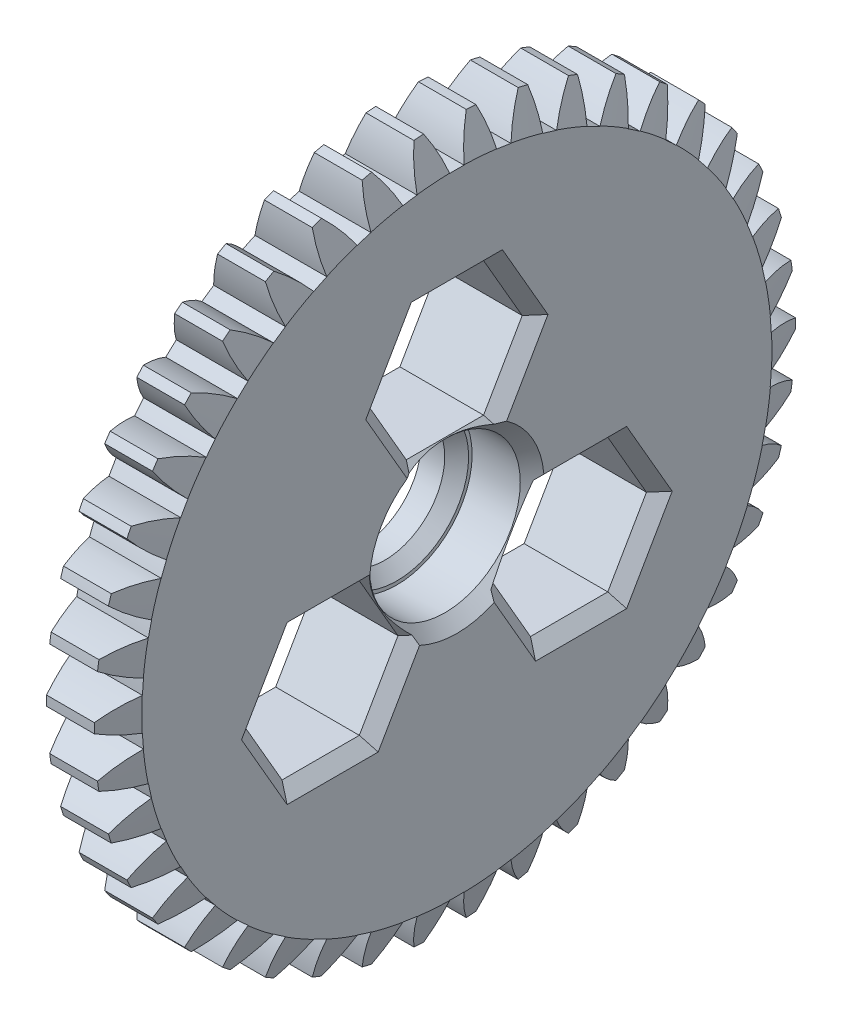
from build123d import *

# Parameters (mm, degrees)
BASPROSKE_W         = 4.7625
BASPROSKE_H         = 23.283333333
TOOTHCUT_DEPTH      = 34.270236375
TEETHCUTS_COUNT     = 42
TEETHCUTS_ANGLE     = 351.428571429
BORSKE_R            = 5.55625
BORE_DEPTH          = 4.7625
SKETCH1_R           = 15.875
SKETCH1_R_2         = 5.55625
BOSS_EXTRUDE1_DEPTH = 1.5875
CUT_EXTRUDE1_DEPTH  = 34.50436472
SKETCH3_R           = 3.9751
BOSS_EXTRUDE2_DEPTH = 6.35
CHAMFER1_SIZE       = 2.3622
CHAMFER1_SIZE2      = 0.79375
SKETCH4_R           = 5.0038
CUT_EXTRUDE2_DEPTH  = 3.9878
CHAMFER2_SIZE       = 0.79375
CHAMFER3_SIZE       = 0.79375
CHAMFER4_SIZE       = 0.79375
CHAMFER4_SIZE2      = 2.3622


with BuildPart() as part:
    # BasProSke → Base-Revolve (revolve)
    with BuildSketch(Plane(origin=(0, 0, 0), x_dir=(1, 0, 0), z_dir=(0, 1, 0)), mode=Mode.PRIVATE) as base_revolve_sk:
        with Locations((2.38125, 11.641666667)):
            Rectangle(BASPROSKE_W, BASPROSKE_H)
    revolve(base_revolve_sk.sketch.rotate(Axis((-10, 0, 0), (1, 0, 0)), 180), axis=Axis((-10, 0, 0), (1, 0, 0)))

    # TooCutSke → ToothCut (cut, through all)
    with BuildSketch(Plane(origin=(0, 0, 0), x_dir=(0, 0, -1), z_dir=(1, 0, 0))):
        with BuildLine():
            ThreePointArc((0.476912223, 20.898759111), (0, 20.9042), (-0.476912223, 20.898759111))
            ThreePointArc((-0.476912223, 20.898759111), (-0.868662684, 22.11616426), (-1.431037522, 23.264762651))
            ThreePointArc((-1.431037522, 23.264762651), (0, 23.308733333), (1.431037522, 23.264762651))
            ThreePointArc((1.431037522, 23.264762651), (0.868662684, 22.11616426), (0.476912223, 20.898759111))
        make_face()
    toothcut = extrude(amount=TOOTHCUT_DEPTH, mode=Mode.SUBTRACT)

    # TeethCuts: ToothCut ×42 about axis
    teethcuts_axis = Axis((-10, 0, 0), (1, 0, 0))
    for i in range(1, TEETHCUTS_COUNT):
        add(toothcut.rotate(teethcuts_axis, i * TEETHCUTS_ANGLE / (TEETHCUTS_COUNT - 1)), mode=Mode.SUBTRACT)

    # BorSke → Bore (cut, symmetric)
    with BuildSketch(Plane(origin=(0, 0, 0), x_dir=(0, 0, -1), z_dir=(1, 0, 0))):
        with Locations(Location((0, 0, 0), (0, 0, 180))):
            Circle(BORSKE_R)
    extrude(amount=BORE_DEPTH, both=True, mode=Mode.SUBTRACT)

    # Sketch1 → Boss-Extrude1 (add)
    with BuildSketch(Plane.ZY):
        with Locations(Location((0, 0, 0), (0, 0, 180))):
            Circle(SKETCH1_R)
        Circle(SKETCH1_R_2, mode=Mode.SUBTRACT)
    extrude(amount=BOSS_EXTRUDE1_DEPTH)

    # Sketch2 → Cut-Extrude1 (cut, through all)
    with BuildSketch(Plane(origin=(4.7625, 0, 0), x_dir=(0, 0, -1), z_dir=(1, 0, 0))):
        Polygon((5.682570024, -9.2075), (10.815213918, -9.2075), (13.381535864, -4.7625), (10.815213918, -0.3175), (5.682570024, -0.3175), (3.116248078, -4.7625), align=None)
        Polygon((5.132643893, 9.525), (2.566321947, 13.97), (-2.566321947, 13.97), (-5.132643893, 9.525), (-2.566321947, 5.08), (2.566321947, 5.08), align=None)
        Polygon((-10.815213918, -0.3175), (-13.381535864, -4.7625), (-10.815213918, -9.2075), (-5.682570024, -9.2075), (-3.116248078, -4.7625), (-5.682570024, -0.3175), align=None)
    extrude(amount=-CUT_EXTRUDE1_DEPTH, mode=Mode.SUBTRACT)

    # Sketch3 → Boss-Extrude2 (add)
    with BuildSketch(Plane(origin=(4.7625, 0, 0), x_dir=(0, 0, -1), z_dir=(1, 0, 0))):
        with BuildLine():
            Line((-3.274074205, -4.489137129), (-5.524743897, -0.590862871))
            ThreePointArc((-5.524743897, -0.590862871), (-4.81185365, 2.778125), (-2.250669692, 5.08))
            Line((-2.250669692, 5.08), (2.250669692, 5.08))
            ThreePointArc((2.250669692, 5.08), (4.81185365, 2.778125), (5.524743897, -0.590862871))
            Line((5.524743897, -0.590862871), (3.274074205, -4.489137129))
            ThreePointArc((3.274074205, -4.489137129), (0, -5.55625), (-3.274074205, -4.489137129))
        make_face()
        Circle(SKETCH3_R, mode=Mode.SUBTRACT)
    extrude(amount=-BOSS_EXTRUDE2_DEPTH)

    # Chamfer1
    chamfer1_edges = [part.edges().sort_by_distance(p)[0] for p in [
        (4.7625, 10.102259726, 20.977558474),
    ]]
    chamfer1_side = [part.faces().sort_by_distance(p)[0] for p in [
        (4.7625, 21.857891001, 1.473947546),
    ]]
    chamfer(chamfer1_edges, length=CHAMFER1_SIZE, length2=CHAMFER1_SIZE2, reference=chamfer1_side[0])

    # CirPattern1: read off the stored shape, not the designer's step
    # CirPattern1 outline → CirPattern1 (revolve, cut)
    with BuildSketch(Plane.YX):
        Polygon((23.283333333, 4.7625), (20.921133333, 4.7625), (23.283333333, 3.96875), align=None)
    revolve(axis=Axis((0, 0, 0), (1, 0, 0)), mode=Mode.SUBTRACT)

    # Sketch4 → Cut-Extrude2 (cut)
    with BuildSketch(Plane(origin=(4.7625, 0, 0), x_dir=(0, 0, -1), z_dir=(1, 0, 0))):
        Circle(SKETCH4_R)
    extrude(amount=-CUT_EXTRUDE2_DEPTH, mode=Mode.SUBTRACT)

    # Chamfer2
    chamfer2_edges = [part.edges().sort_by_distance(p)[0] for p in [
        (0.7747, 0, 3.9751),
    ]]
    chamfer(chamfer2_edges, length=CHAMFER2_SIZE)

    # Chamfer3
    # the kernel refuses this chamfer: 0.79375 mm, written as the material it takes off along each edge
    with BuildSketch(Plane(origin=(4.7625, 0, 0), x_dir=(0, 0, -1), z_dir=(0, -1, 0))) as chamfer3_piece_1:
        Polygon((5.0038, -CHAMFER3_SIZE), (5.0038 + CHAMFER3_SIZE, 0), (5.0038, 0), align=None)
    chamfer3_piece_1_solid = revolve(axis=Axis((4.7625, 0, 0), (1, 0, 0)), mode=Mode.PRIVATE)
    with BuildSketch(Plane(origin=(4.7625, 5.08, -4.607595318), x_dir=(0, -1, 0), z_dir=(0, 0, 1))) as chamfer3_piece_2_section:
        Polygon((CHAMFER3_SIZE, 0), (0, -CHAMFER3_SIZE), (0, 0), align=None)
    chamfer3_piece_2 = extrude(amount=9.215190636, mode=Mode.PRIVATE)
    chamfer3_piece_2 = split(chamfer3_piece_2, bisect_by=Plane(origin=(4.7625, 1.973602702, 0.77284263), z_dir=(0, 0.49999999999999994, -0.8660254037844387)), keep=Keep.TOP, mode=Mode.PRIVATE)
    chamfer3_piece_2 = split(chamfer3_piece_2, bisect_by=Plane(origin=(4.7625, 5.963897298, -3.076640289), z_dir=(0, 0.5000000000000001, 0.8660254037844387)), keep=Keep.TOP, mode=Mode.PRIVATE)
    with BuildSketch(Plane(origin=(4.7625, 3.312205404, -1.545685261), x_dir=(-2.237929876409765e-15, -0.5, -0.8660254037844386), z_dir=(0, 0.8660254037844387, -0.5000000000000001))) as chamfer3_piece_3_section:
        Polygon((CHAMFER3_SIZE, 0), (0, CHAMFER3_SIZE), (0, 0), align=None)
    chamfer3_piece_3 = extrude(amount=9.215190636, mode=Mode.PRIVATE)
    chamfer3_piece_3 = split(chamfer3_piece_3, bisect_by=Plane(origin=(4.7625, 5.08, -1.545685261), z_dir=(0, 1, 0)), keep=Keep.TOP, mode=Mode.PRIVATE)
    chamfer3_piece_3 = split(chamfer3_piece_3, bisect_by=Plane(origin=(4.7625, 6.418602702, -6.926123209), z_dir=(0, -0.5000000000000001, 0.8660254037844387)), keep=Keep.TOP, mode=Mode.PRIVATE)
    with BuildSketch(Plane(origin=(4.7625, 7.757205404, -6.153280579), x_dir=(-2.237929876409766e-15, 0.5000000000000001, -0.8660254037844387), z_dir=(0, 0.8660254037844387, 0.5000000000000001))) as chamfer3_piece_4_section:
        Polygon((CHAMFER3_SIZE, 0), (0, CHAMFER3_SIZE), (0, 0), align=None)
    chamfer3_piece_4 = extrude(amount=9.215190636, mode=Mode.PRIVATE)
    chamfer3_piece_4 = split(chamfer3_piece_4, bisect_by=Plane(origin=(4.7625, 13.97, -6.153280579), z_dir=(0, -1, 0)), keep=Keep.TOP, mode=Mode.PRIVATE)
    chamfer3_piece_4 = split(chamfer3_piece_4, bisect_by=Plane(origin=(4.7625, 8.641102702, -4.62232555), z_dir=(0, 0.5000000000000001, 0.8660254037844387)), keep=Keep.TOP, mode=Mode.PRIVATE)
    with BuildSketch(Plane(origin=(4.7625, 13.97, -4.607595318), x_dir=(0, 1, 0), z_dir=(0, 0, 1))) as chamfer3_piece_5_section:
        Polygon((CHAMFER3_SIZE, 0), (0, CHAMFER3_SIZE), (0, 0), align=None)
    chamfer3_piece_5 = extrude(amount=9.215190636, mode=Mode.PRIVATE)
    chamfer3_piece_5 = split(chamfer3_piece_5, bisect_by=Plane(origin=(4.7625, 17.076397298, 0.77284263), z_dir=(0, -0.5000000000000001, -0.8660254037844386)), keep=Keep.TOP, mode=Mode.PRIVATE)
    chamfer3_piece_5 = split(chamfer3_piece_5, bisect_by=Plane(origin=(4.7625, 13.086102702, -3.076640289), z_dir=(0, -0.5000000000000001, 0.8660254037844387)), keep=Keep.TOP, mode=Mode.PRIVATE)
    with BuildSketch(Plane(origin=(4.7625, 15.737794596, 1.545685261), x_dir=(-2.2379298764097628e-15, 0.5000000000000001, 0.8660254037844387), z_dir=(0, -0.8660254037844386, 0.5000000000000001))) as chamfer3_piece_6_section:
        Polygon((CHAMFER3_SIZE, 0), (0, CHAMFER3_SIZE), (0, 0), align=None)
    chamfer3_piece_6 = extrude(amount=9.215190636, mode=Mode.PRIVATE)
    chamfer3_piece_6 = split(chamfer3_piece_6, bisect_by=Plane(origin=(4.7625, 12.631397298, 6.926123209), z_dir=(0, 0.49999999999999994, -0.8660254037844387)), keep=Keep.TOP, mode=Mode.PRIVATE)
    chamfer3_piece_6 = split(chamfer3_piece_6, bisect_by=Plane(origin=(4.7625, 13.97, 1.545685261), z_dir=(0, -1, 0)), keep=Keep.TOP, mode=Mode.PRIVATE)
    with BuildSketch(Plane(origin=(4.7625, 11.292794596, 6.153280579), x_dir=(-2.2379298764097643e-15, -0.49999999999999994, 0.8660254037844387), z_dir=(0, -0.8660254037844387, -0.49999999999999994))) as chamfer3_piece_7_section:
        Polygon((CHAMFER3_SIZE, 0), (0, CHAMFER3_SIZE), (0, 0), align=None)
    chamfer3_piece_7 = extrude(amount=9.215190636, mode=Mode.PRIVATE)
    chamfer3_piece_7 = split(chamfer3_piece_7, bisect_by=Plane(origin=(4.7625, 10.408897298, 4.62232555), z_dir=(0, -0.5000000000000001, -0.8660254037844386)), keep=Keep.TOP, mode=Mode.PRIVATE)
    chamfer3_piece_7 = split(chamfer3_piece_7, bisect_by=Plane(origin=(4.7625, 5.08, 6.153280579), z_dir=(0, 1, 0)), keep=Keep.TOP, mode=Mode.PRIVATE)
    with BuildSketch(Plane(origin=(4.7625, -6.530294596, -2.095611392), x_dir=(-2.2379298764097647e-15, 0.5000000000000042, 0.8660254037844362), z_dir=(0, 0.8660254037844363, -0.5000000000000043))) as chamfer3_piece_8_section:
        Polygon((CHAMFER3_SIZE, 0), (0, -CHAMFER3_SIZE), (0, 0), align=None)
    chamfer3_piece_8 = extrude(amount=9.215190636, mode=Mode.PRIVATE)
    chamfer3_piece_8 = split(chamfer3_piece_8, bisect_by=Plane(origin=(4.7625, -0.3175, -2.095611392), z_dir=(0, -1, 0)), keep=Keep.TOP, mode=Mode.PRIVATE)
    chamfer3_piece_8 = split(chamfer3_piece_8, bisect_by=Plane(origin=(4.7625, -5.646397298, -3.626566421), z_dir=(0, 0.49999999999999584, -0.866025403784441)), keep=Keep.TOP, mode=Mode.PRIVATE)
    with BuildSketch(Plane(origin=(4.7625, -2.994705404, -2.095611392), x_dir=(-2.2379298764097635e-15, -0.4999999999999958, 0.866025403784441), z_dir=(0, -0.866025403784441, -0.49999999999999584))) as chamfer3_piece_9_section:
        Polygon((CHAMFER3_SIZE, 0), (0, CHAMFER3_SIZE), (0, 0), align=None)
    chamfer3_piece_9 = extrude(amount=9.215190636, mode=Mode.PRIVATE)
    chamfer3_piece_9 = split(chamfer3_piece_9, bisect_by=Plane(origin=(4.7625, -3.878602702, -3.626566421), z_dir=(0, -0.5000000000000043, -0.8660254037844363)), keep=Keep.TOP, mode=Mode.PRIVATE)
    chamfer3_piece_9 = split(chamfer3_piece_9, bisect_by=Plane(origin=(4.7625, -9.2075, -2.095611392), z_dir=(0, 1, 0)), keep=Keep.TOP, mode=Mode.PRIVATE)
    with BuildSketch(Plane(origin=(4.7625, -9.2075, -3.641296653), x_dir=(0, -1, 0), z_dir=(0, 0, -1))) as chamfer3_piece_10_section:
        Polygon((CHAMFER3_SIZE, 0), (0, CHAMFER3_SIZE), (0, 0), align=None)
    chamfer3_piece_10 = extrude(amount=9.215190636, mode=Mode.PRIVATE)
    chamfer3_piece_10 = split(chamfer3_piece_10, bisect_by=Plane(origin=(4.7625, -12.313897298, -9.021734601), z_dir=(0, 0.5000000000000038, 0.8660254037844365)), keep=Keep.TOP, mode=Mode.PRIVATE)
    chamfer3_piece_10 = split(chamfer3_piece_10, bisect_by=Plane(origin=(4.7625, -8.323602702, -5.172251682), z_dir=(0, 0.49999999999999584, -0.866025403784441)), keep=Keep.TOP, mode=Mode.PRIVATE)
    with BuildSketch(Plane(origin=(4.7625, -10.975294596, -9.794577232), x_dir=(-2.2379298764097635e-15, -0.5000000000000038, -0.8660254037844364), z_dir=(0, 0.8660254037844365, -0.5000000000000038))) as chamfer3_piece_11_section:
        Polygon((CHAMFER3_SIZE, 0), (0, CHAMFER3_SIZE), (0, 0), align=None)
    chamfer3_piece_11 = extrude(amount=9.215190636, mode=Mode.PRIVATE)
    chamfer3_piece_11 = split(chamfer3_piece_11, bisect_by=Plane(origin=(4.7625, -7.868897298, -15.17501518), z_dir=(0, -0.4999999999999959, 0.866025403784441)), keep=Keep.TOP, mode=Mode.PRIVATE)
    chamfer3_piece_11 = split(chamfer3_piece_11, bisect_by=Plane(origin=(4.7625, -9.2075, -9.794577232), z_dir=(0, 1, 0)), keep=Keep.TOP, mode=Mode.PRIVATE)
    with BuildSketch(Plane(origin=(4.7625, -6.530294596, -14.40217255), x_dir=(-2.237929876409765e-15, 0.49999999999999595, -0.866025403784441), z_dir=(0, 0.866025403784441, 0.4999999999999959))) as chamfer3_piece_12_section:
        Polygon((CHAMFER3_SIZE, 0), (0, CHAMFER3_SIZE), (0, 0), align=None)
    chamfer3_piece_12 = extrude(amount=9.215190636, mode=Mode.PRIVATE)
    chamfer3_piece_12 = split(chamfer3_piece_12, bisect_by=Plane(origin=(4.7625, -0.3175, -14.40217255), z_dir=(0, -1, 0)), keep=Keep.TOP, mode=Mode.PRIVATE)
    chamfer3_piece_12 = split(chamfer3_piece_12, bisect_by=Plane(origin=(4.7625, -5.646397298, -12.871217521), z_dir=(0, 0.5000000000000038, 0.8660254037844365)), keep=Keep.TOP, mode=Mode.PRIVATE)
    with BuildSketch(Plane(origin=(4.7625, -0.3175, -12.856487289), x_dir=(0, 1, 0), z_dir=(0, 0, 1))) as chamfer3_piece_13_section:
        Polygon((CHAMFER3_SIZE, 0), (0, CHAMFER3_SIZE), (0, 0), align=None)
    chamfer3_piece_13 = extrude(amount=9.215190636, mode=Mode.PRIVATE)
    chamfer3_piece_13 = split(chamfer3_piece_13, bisect_by=Plane(origin=(4.7625, -1.201397298, -11.325532261), z_dir=(0, -0.4999999999999959, 0.866025403784441)), keep=Keep.TOP, mode=Mode.PRIVATE)
    chamfer3_piece_13 = split(chamfer3_piece_13, bisect_by=Plane(origin=(4.7625, 2.788897298, -7.476049341), z_dir=(0, -0.5000000000000043, -0.8660254037844363)), keep=Keep.TOP, mode=Mode.PRIVATE)
    with BuildSketch(Plane(origin=(4.7625, 1.450294596, 6.70320671), x_dir=(-2.2379298764097643e-15, 0.4999999999999917, -0.8660254037844435), z_dir=(0, -0.8660254037844435, -0.4999999999999917))) as chamfer3_piece_14_section:
        Polygon((CHAMFER3_SIZE, 0), (0, -CHAMFER3_SIZE), (0, 0), align=None)
    chamfer3_piece_14 = extrude(amount=9.215190636, mode=Mode.PRIVATE)
    chamfer3_piece_14 = split(chamfer3_piece_14, bisect_by=Plane(origin=(4.7625, -1.656102702, 1.322768762), z_dir=(0, 0.5000000000000082, 0.8660254037844339)), keep=Keep.TOP, mode=Mode.PRIVATE)
    chamfer3_piece_14 = split(chamfer3_piece_14, bisect_by=Plane(origin=(4.7625, -0.3175, 6.70320671), z_dir=(0, -1, 0)), keep=Keep.TOP, mode=Mode.PRIVATE)
    with BuildSketch(Plane(origin=(4.7625, -0.3175, 3.641296653), x_dir=(0, 1, 0), z_dir=(0, 0, 1))) as chamfer3_piece_15_section:
        Polygon((CHAMFER3_SIZE, 0), (0, CHAMFER3_SIZE), (0, 0), align=None)
    chamfer3_piece_15 = extrude(amount=9.215190636, mode=Mode.PRIVATE)
    chamfer3_piece_15 = split(chamfer3_piece_15, bisect_by=Plane(origin=(4.7625, -1.201397298, 5.172251682), z_dir=(0, -0.4999999999999917, 0.8660254037844435)), keep=Keep.TOP, mode=Mode.PRIVATE)
    chamfer3_piece_15 = split(chamfer3_piece_15, bisect_by=Plane(origin=(4.7625, 2.788897298, 9.021734601), z_dir=(0, -0.5000000000000081, -0.8660254037844339)), keep=Keep.TOP, mode=Mode.PRIVATE)
    with BuildSketch(Plane(origin=(4.7625, 1.450294596, 9.794577232), x_dir=(-2.2379298764097635e-15, 0.5000000000000082, 0.8660254037844339), z_dir=(0, -0.866025403784434, 0.5000000000000082))) as chamfer3_piece_16_section:
        Polygon((CHAMFER3_SIZE, 0), (0, CHAMFER3_SIZE), (0, 0), align=None)
    chamfer3_piece_16 = extrude(amount=9.215190636, mode=Mode.PRIVATE)
    chamfer3_piece_16 = split(chamfer3_piece_16, bisect_by=Plane(origin=(4.7625, -1.656102702, 15.17501518), z_dir=(0, 0.4999999999999916, -0.8660254037844436)), keep=Keep.TOP, mode=Mode.PRIVATE)
    chamfer3_piece_16 = split(chamfer3_piece_16, bisect_by=Plane(origin=(4.7625, -0.3175, 9.794577232), z_dir=(0, -1, 0)), keep=Keep.TOP, mode=Mode.PRIVATE)
    with BuildSketch(Plane(origin=(4.7625, -2.994705404, 14.40217255), x_dir=(-2.2379298764097643e-15, -0.49999999999999156, 0.8660254037844435), z_dir=(0, -0.8660254037844435, -0.49999999999999156))) as chamfer3_piece_17_section:
        Polygon((CHAMFER3_SIZE, 0), (0, CHAMFER3_SIZE), (0, 0), align=None)
    chamfer3_piece_17 = extrude(amount=9.215190636, mode=Mode.PRIVATE)
    chamfer3_piece_17 = split(chamfer3_piece_17, bisect_by=Plane(origin=(4.7625, -9.2075, 14.40217255), z_dir=(0, 1, 0)), keep=Keep.TOP, mode=Mode.PRIVATE)
    chamfer3_piece_17 = split(chamfer3_piece_17, bisect_by=Plane(origin=(4.7625, -3.878602702, 12.871217521), z_dir=(0, -0.5000000000000081, -0.8660254037844339)), keep=Keep.TOP, mode=Mode.PRIVATE)
    with BuildSketch(Plane(origin=(4.7625, -9.2075, 12.856487289), x_dir=(0, -1, 0), z_dir=(0, 0, -1))) as chamfer3_piece_18_section:
        Polygon((CHAMFER3_SIZE, 0), (0, CHAMFER3_SIZE), (0, 0), align=None)
    chamfer3_piece_18 = extrude(amount=9.215190636, mode=Mode.PRIVATE)
    chamfer3_piece_18 = split(chamfer3_piece_18, bisect_by=Plane(origin=(4.7625, -12.313897298, 7.476049341), z_dir=(0, 0.5000000000000082, 0.8660254037844339)), keep=Keep.TOP, mode=Mode.PRIVATE)
    chamfer3_piece_18 = split(chamfer3_piece_18, bisect_by=Plane(origin=(4.7625, -8.323602702, 11.325532261), z_dir=(0, 0.4999999999999916, -0.8660254037844436)), keep=Keep.TOP, mode=Mode.PRIVATE)
    with BuildSketch(Plane(origin=(4.7625, -10.975294596, 6.70320671), x_dir=(-2.2379298764097628e-15, -0.5000000000000082, -0.8660254037844339), z_dir=(0, 0.8660254037844339, -0.5000000000000082))) as chamfer3_piece_19_section:
        Polygon((CHAMFER3_SIZE, 0), (0, CHAMFER3_SIZE), (0, 0), align=None)
    chamfer3_piece_19 = extrude(amount=9.215190636, mode=Mode.PRIVATE)
    chamfer3_piece_19 = split(chamfer3_piece_19, bisect_by=Plane(origin=(4.7625, -9.2075, 6.70320671), z_dir=(0, 1, 0)), keep=Keep.TOP, mode=Mode.PRIVATE)
    chamfer3_piece_19 = split(chamfer3_piece_19, bisect_by=Plane(origin=(4.7625, -7.868897298, 1.322768762), z_dir=(0, -0.4999999999999917, 0.8660254037844435)), keep=Keep.TOP, mode=Mode.PRIVATE)
    with BuildSketch(Plane(origin=(4.7625, 5.08, -4.607595318), x_dir=(0, -1, 0), z_dir=(0, 0, 1))) as chamfer3_piece_20a_section:
        Polygon((CHAMFER3_SIZE, 0), (0, -CHAMFER3_SIZE), (0, 0), align=None)
    chamfer3_piece_20a = extrude(amount=9.215190636, mode=Mode.PRIVATE)
    chamfer3_piece_20a = chamfer3_piece_20a - Plane(origin=(4.7625, 0, 0), x_dir=(0, 0, -1), z_dir=(1, 0, 0)) * Cylinder(5.0038, 22, mode=Mode.PRIVATE)
    chamfer3_piece_20a = split(chamfer3_piece_20a, bisect_by=Plane(origin=(4.7625, 5.963897298, -3.076640289), z_dir=(0, -0.5000000000000001, -0.8660254037844387)), keep=Keep.TOP, mode=Mode.PRIVATE)
    with BuildSketch(Plane(origin=(4.7625, 3.312205404, -1.545685261), x_dir=(-2.237929876409765e-15, -0.5, -0.8660254037844386), z_dir=(0, 0.8660254037844387, -0.5000000000000001))) as chamfer3_piece_20b_section:
        Polygon((CHAMFER3_SIZE, 0), (0, CHAMFER3_SIZE), (0, 0), align=None)
    chamfer3_piece_20b = extrude(amount=9.215190636, mode=Mode.PRIVATE)
    chamfer3_piece_20b = chamfer3_piece_20b - Plane(origin=(4.7625, 0, 0), x_dir=(0, 0, -1), z_dir=(1, 0, 0)) * Cylinder(5.0038, 22, mode=Mode.PRIVATE)
    chamfer3_piece_20b = split(chamfer3_piece_20b, bisect_by=Plane(origin=(4.7625, 5.08, -1.545685261), z_dir=(0, -1, 0)), keep=Keep.TOP, mode=Mode.PRIVATE)
    chamfer3_piece_20 = chamfer3_piece_20a & chamfer3_piece_20b
    with BuildSketch(Plane(origin=(4.7625, 11.292794596, 6.153280579), x_dir=(-2.2379298764097643e-15, -0.49999999999999994, 0.8660254037844387), z_dir=(0, -0.8660254037844387, -0.49999999999999994))) as chamfer3_piece_21a_section:
        Polygon((CHAMFER3_SIZE, 0), (0, CHAMFER3_SIZE), (0, 0), align=None)
    chamfer3_piece_21a = extrude(amount=9.215190636, mode=Mode.PRIVATE)
    chamfer3_piece_21a = chamfer3_piece_21a - Plane(origin=(4.7625, 0, 0), x_dir=(0, 0, -1), z_dir=(1, 0, 0)) * Cylinder(5.0038, 22, mode=Mode.PRIVATE)
    chamfer3_piece_21a = split(chamfer3_piece_21a, bisect_by=Plane(origin=(4.7625, 5.08, 6.153280579), z_dir=(0, -1, 0)), keep=Keep.TOP, mode=Mode.PRIVATE)
    with BuildSketch(Plane(origin=(4.7625, 5.08, -4.607595318), x_dir=(0, -1, 0), z_dir=(0, 0, 1))) as chamfer3_piece_21b_section:
        Polygon((CHAMFER3_SIZE, 0), (0, -CHAMFER3_SIZE), (0, 0), align=None)
    chamfer3_piece_21b = extrude(amount=9.215190636, mode=Mode.PRIVATE)
    chamfer3_piece_21b = chamfer3_piece_21b - Plane(origin=(4.7625, 0, 0), x_dir=(0, 0, -1), z_dir=(1, 0, 0)) * Cylinder(5.0038, 22, mode=Mode.PRIVATE)
    chamfer3_piece_21b = split(chamfer3_piece_21b, bisect_by=Plane(origin=(4.7625, 1.973602702, 0.77284263), z_dir=(0, -0.49999999999999994, 0.8660254037844387)), keep=Keep.TOP, mode=Mode.PRIVATE)
    chamfer3_piece_21 = chamfer3_piece_21a & chamfer3_piece_21b
    with BuildSketch(Plane(origin=(4.7625, 3.312205404, -1.545685261), x_dir=(-2.237929876409765e-15, -0.5, -0.8660254037844386), z_dir=(0, 0.8660254037844387, -0.5000000000000001))) as chamfer3_piece_22a_section:
        Polygon((CHAMFER3_SIZE, 0), (0, CHAMFER3_SIZE), (0, 0), align=None)
    chamfer3_piece_22a = extrude(amount=9.215190636, mode=Mode.PRIVATE)
    chamfer3_piece_22a = split(chamfer3_piece_22a, bisect_by=Plane(origin=(4.7625, 6.418602702, -6.926123209), z_dir=(0, 0.5000000000000001, -0.8660254037844387)), keep=Keep.TOP, mode=Mode.PRIVATE)
    with BuildSketch(Plane(origin=(4.7625, 7.757205404, -6.153280579), x_dir=(-2.237929876409766e-15, 0.5000000000000001, -0.8660254037844387), z_dir=(0, 0.8660254037844387, 0.5000000000000001))) as chamfer3_piece_22b_section:
        Polygon((CHAMFER3_SIZE, 0), (0, CHAMFER3_SIZE), (0, 0), align=None)
    chamfer3_piece_22b = extrude(amount=9.215190636, mode=Mode.PRIVATE)
    chamfer3_piece_22b = split(chamfer3_piece_22b, bisect_by=Plane(origin=(4.7625, 8.641102702, -4.62232555), z_dir=(0, -0.5000000000000001, -0.8660254037844387)), keep=Keep.TOP, mode=Mode.PRIVATE)
    chamfer3_piece_22 = chamfer3_piece_22a & chamfer3_piece_22b
    with BuildSketch(Plane(origin=(4.7625, 13.97, -4.607595318), x_dir=(0, 1, 0), z_dir=(0, 0, 1))) as chamfer3_piece_23a_section:
        Polygon((CHAMFER3_SIZE, 0), (0, CHAMFER3_SIZE), (0, 0), align=None)
    chamfer3_piece_23a = extrude(amount=9.215190636, mode=Mode.PRIVATE)
    chamfer3_piece_23a = split(chamfer3_piece_23a, bisect_by=Plane(origin=(4.7625, 13.086102702, -3.076640289), z_dir=(0, 0.5000000000000001, -0.8660254037844387)), keep=Keep.TOP, mode=Mode.PRIVATE)
    with BuildSketch(Plane(origin=(4.7625, 7.757205404, -6.153280579), x_dir=(-2.237929876409766e-15, 0.5000000000000001, -0.8660254037844387), z_dir=(0, 0.8660254037844387, 0.5000000000000001))) as chamfer3_piece_23b_section:
        Polygon((CHAMFER3_SIZE, 0), (0, CHAMFER3_SIZE), (0, 0), align=None)
    chamfer3_piece_23b = extrude(amount=9.215190636, mode=Mode.PRIVATE)
    chamfer3_piece_23b = split(chamfer3_piece_23b, bisect_by=Plane(origin=(4.7625, 13.97, -6.153280579), z_dir=(0, 1, 0)), keep=Keep.TOP, mode=Mode.PRIVATE)
    chamfer3_piece_23 = chamfer3_piece_23a & chamfer3_piece_23b
    with BuildSketch(Plane(origin=(4.7625, 15.737794596, 1.545685261), x_dir=(-2.2379298764097628e-15, 0.5000000000000001, 0.8660254037844387), z_dir=(0, -0.8660254037844386, 0.5000000000000001))) as chamfer3_piece_24a_section:
        Polygon((CHAMFER3_SIZE, 0), (0, CHAMFER3_SIZE), (0, 0), align=None)
    chamfer3_piece_24a = extrude(amount=9.215190636, mode=Mode.PRIVATE)
    chamfer3_piece_24a = split(chamfer3_piece_24a, bisect_by=Plane(origin=(4.7625, 13.97, 1.545685261), z_dir=(0, 1, 0)), keep=Keep.TOP, mode=Mode.PRIVATE)
    with BuildSketch(Plane(origin=(4.7625, 13.97, -4.607595318), x_dir=(0, 1, 0), z_dir=(0, 0, 1))) as chamfer3_piece_24b_section:
        Polygon((CHAMFER3_SIZE, 0), (0, CHAMFER3_SIZE), (0, 0), align=None)
    chamfer3_piece_24b = extrude(amount=9.215190636, mode=Mode.PRIVATE)
    chamfer3_piece_24b = split(chamfer3_piece_24b, bisect_by=Plane(origin=(4.7625, 17.076397298, 0.77284263), z_dir=(0, 0.5000000000000001, 0.8660254037844386)), keep=Keep.TOP, mode=Mode.PRIVATE)
    chamfer3_piece_24 = chamfer3_piece_24a & chamfer3_piece_24b
    with BuildSketch(Plane(origin=(4.7625, 11.292794596, 6.153280579), x_dir=(-2.2379298764097643e-15, -0.49999999999999994, 0.8660254037844387), z_dir=(0, -0.8660254037844387, -0.49999999999999994))) as chamfer3_piece_25a_section:
        Polygon((CHAMFER3_SIZE, 0), (0, CHAMFER3_SIZE), (0, 0), align=None)
    chamfer3_piece_25a = extrude(amount=9.215190636, mode=Mode.PRIVATE)
    chamfer3_piece_25a = split(chamfer3_piece_25a, bisect_by=Plane(origin=(4.7625, 10.408897298, 4.62232555), z_dir=(0, 0.5000000000000001, 0.8660254037844386)), keep=Keep.TOP, mode=Mode.PRIVATE)
    with BuildSketch(Plane(origin=(4.7625, 15.737794596, 1.545685261), x_dir=(-2.2379298764097628e-15, 0.5000000000000001, 0.8660254037844387), z_dir=(0, -0.8660254037844386, 0.5000000000000001))) as chamfer3_piece_25b_section:
        Polygon((CHAMFER3_SIZE, 0), (0, CHAMFER3_SIZE), (0, 0), align=None)
    chamfer3_piece_25b = extrude(amount=9.215190636, mode=Mode.PRIVATE)
    chamfer3_piece_25b = split(chamfer3_piece_25b, bisect_by=Plane(origin=(4.7625, 12.631397298, 6.926123209), z_dir=(0, -0.49999999999999994, 0.8660254037844387)), keep=Keep.TOP, mode=Mode.PRIVATE)
    chamfer3_piece_25 = chamfer3_piece_25a & chamfer3_piece_25b
    with BuildSketch(Plane(origin=(4.7625, -6.530294596, -2.095611392), x_dir=(-2.2379298764097647e-15, 0.5000000000000042, 0.8660254037844362), z_dir=(0, 0.8660254037844363, -0.5000000000000043))) as chamfer3_piece_26a_section:
        Polygon((CHAMFER3_SIZE, 0), (0, -CHAMFER3_SIZE), (0, 0), align=None)
    chamfer3_piece_26a = extrude(amount=9.215190636, mode=Mode.PRIVATE)
    chamfer3_piece_26a = chamfer3_piece_26a - Plane(origin=(4.7625, 0, 0), x_dir=(0, 0, -1), z_dir=(1, 0, 0)) * Cylinder(5.0038, 22, mode=Mode.PRIVATE)
    chamfer3_piece_26a = split(chamfer3_piece_26a, bisect_by=Plane(origin=(4.7625, -5.646397298, -3.626566421), z_dir=(0, -0.49999999999999584, 0.866025403784441)), keep=Keep.TOP, mode=Mode.PRIVATE)
    with BuildSketch(Plane(origin=(4.7625, -2.994705404, -2.095611392), x_dir=(-2.2379298764097635e-15, -0.4999999999999958, 0.866025403784441), z_dir=(0, -0.866025403784441, -0.49999999999999584))) as chamfer3_piece_26b_section:
        Polygon((CHAMFER3_SIZE, 0), (0, CHAMFER3_SIZE), (0, 0), align=None)
    chamfer3_piece_26b = extrude(amount=9.215190636, mode=Mode.PRIVATE)
    chamfer3_piece_26b = chamfer3_piece_26b - Plane(origin=(4.7625, 0, 0), x_dir=(0, 0, -1), z_dir=(1, 0, 0)) * Cylinder(5.0038, 22, mode=Mode.PRIVATE)
    chamfer3_piece_26b = split(chamfer3_piece_26b, bisect_by=Plane(origin=(4.7625, -3.878602702, -3.626566421), z_dir=(0, 0.5000000000000043, 0.8660254037844363)), keep=Keep.TOP, mode=Mode.PRIVATE)
    chamfer3_piece_26 = chamfer3_piece_26a & chamfer3_piece_26b
    with BuildSketch(Plane(origin=(4.7625, -0.3175, -12.856487289), x_dir=(0, 1, 0), z_dir=(0, 0, 1))) as chamfer3_piece_27a_section:
        Polygon((CHAMFER3_SIZE, 0), (0, CHAMFER3_SIZE), (0, 0), align=None)
    chamfer3_piece_27a = extrude(amount=9.215190636, mode=Mode.PRIVATE)
    chamfer3_piece_27a = chamfer3_piece_27a - Plane(origin=(4.7625, 0, 0), x_dir=(0, 0, -1), z_dir=(1, 0, 0)) * Cylinder(5.0038, 22, mode=Mode.PRIVATE)
    chamfer3_piece_27a = split(chamfer3_piece_27a, bisect_by=Plane(origin=(4.7625, 2.788897298, -7.476049341), z_dir=(0, 0.5000000000000043, 0.8660254037844363)), keep=Keep.TOP, mode=Mode.PRIVATE)
    with BuildSketch(Plane(origin=(4.7625, -6.530294596, -2.095611392), x_dir=(-2.2379298764097647e-15, 0.5000000000000042, 0.8660254037844362), z_dir=(0, 0.8660254037844363, -0.5000000000000043))) as chamfer3_piece_27b_section:
        Polygon((CHAMFER3_SIZE, 0), (0, -CHAMFER3_SIZE), (0, 0), align=None)
    chamfer3_piece_27b = extrude(amount=9.215190636, mode=Mode.PRIVATE)
    chamfer3_piece_27b = chamfer3_piece_27b - Plane(origin=(4.7625, 0, 0), x_dir=(0, 0, -1), z_dir=(1, 0, 0)) * Cylinder(5.0038, 22, mode=Mode.PRIVATE)
    chamfer3_piece_27b = split(chamfer3_piece_27b, bisect_by=Plane(origin=(4.7625, -0.3175, -2.095611392), z_dir=(0, 1, 0)), keep=Keep.TOP, mode=Mode.PRIVATE)
    chamfer3_piece_27 = chamfer3_piece_27a & chamfer3_piece_27b
    with BuildSketch(Plane(origin=(4.7625, -2.994705404, -2.095611392), x_dir=(-2.2379298764097635e-15, -0.4999999999999958, 0.866025403784441), z_dir=(0, -0.866025403784441, -0.49999999999999584))) as chamfer3_piece_28a_section:
        Polygon((CHAMFER3_SIZE, 0), (0, CHAMFER3_SIZE), (0, 0), align=None)
    chamfer3_piece_28a = extrude(amount=9.215190636, mode=Mode.PRIVATE)
    chamfer3_piece_28a = split(chamfer3_piece_28a, bisect_by=Plane(origin=(4.7625, -9.2075, -2.095611392), z_dir=(0, -1, 0)), keep=Keep.TOP, mode=Mode.PRIVATE)
    with BuildSketch(Plane(origin=(4.7625, -9.2075, -3.641296653), x_dir=(0, -1, 0), z_dir=(0, 0, -1))) as chamfer3_piece_28b_section:
        Polygon((CHAMFER3_SIZE, 0), (0, CHAMFER3_SIZE), (0, 0), align=None)
    chamfer3_piece_28b = extrude(amount=9.215190636, mode=Mode.PRIVATE)
    chamfer3_piece_28b = split(chamfer3_piece_28b, bisect_by=Plane(origin=(4.7625, -8.323602702, -5.172251682), z_dir=(0, -0.49999999999999584, 0.866025403784441)), keep=Keep.TOP, mode=Mode.PRIVATE)
    chamfer3_piece_28 = chamfer3_piece_28a & chamfer3_piece_28b
    with BuildSketch(Plane(origin=(4.7625, -10.975294596, -9.794577232), x_dir=(-2.2379298764097635e-15, -0.5000000000000038, -0.8660254037844364), z_dir=(0, 0.8660254037844365, -0.5000000000000038))) as chamfer3_piece_29a_section:
        Polygon((CHAMFER3_SIZE, 0), (0, CHAMFER3_SIZE), (0, 0), align=None)
    chamfer3_piece_29a = extrude(amount=9.215190636, mode=Mode.PRIVATE)
    chamfer3_piece_29a = split(chamfer3_piece_29a, bisect_by=Plane(origin=(4.7625, -9.2075, -9.794577232), z_dir=(0, -1, 0)), keep=Keep.TOP, mode=Mode.PRIVATE)
    with BuildSketch(Plane(origin=(4.7625, -9.2075, -3.641296653), x_dir=(0, -1, 0), z_dir=(0, 0, -1))) as chamfer3_piece_29b_section:
        Polygon((CHAMFER3_SIZE, 0), (0, CHAMFER3_SIZE), (0, 0), align=None)
    chamfer3_piece_29b = extrude(amount=9.215190636, mode=Mode.PRIVATE)
    chamfer3_piece_29b = split(chamfer3_piece_29b, bisect_by=Plane(origin=(4.7625, -12.313897298, -9.021734601), z_dir=(0, -0.5000000000000038, -0.8660254037844365)), keep=Keep.TOP, mode=Mode.PRIVATE)
    chamfer3_piece_29 = chamfer3_piece_29a & chamfer3_piece_29b
    with BuildSketch(Plane(origin=(4.7625, -6.530294596, -14.40217255), x_dir=(-2.237929876409765e-15, 0.49999999999999595, -0.866025403784441), z_dir=(0, 0.866025403784441, 0.4999999999999959))) as chamfer3_piece_30a_section:
        Polygon((CHAMFER3_SIZE, 0), (0, CHAMFER3_SIZE), (0, 0), align=None)
    chamfer3_piece_30a = extrude(amount=9.215190636, mode=Mode.PRIVATE)
    chamfer3_piece_30a = split(chamfer3_piece_30a, bisect_by=Plane(origin=(4.7625, -5.646397298, -12.871217521), z_dir=(0, -0.5000000000000038, -0.8660254037844365)), keep=Keep.TOP, mode=Mode.PRIVATE)
    with BuildSketch(Plane(origin=(4.7625, -10.975294596, -9.794577232), x_dir=(-2.2379298764097635e-15, -0.5000000000000038, -0.8660254037844364), z_dir=(0, 0.8660254037844365, -0.5000000000000038))) as chamfer3_piece_30b_section:
        Polygon((CHAMFER3_SIZE, 0), (0, CHAMFER3_SIZE), (0, 0), align=None)
    chamfer3_piece_30b = extrude(amount=9.215190636, mode=Mode.PRIVATE)
    chamfer3_piece_30b = split(chamfer3_piece_30b, bisect_by=Plane(origin=(4.7625, -7.868897298, -15.17501518), z_dir=(0, 0.4999999999999959, -0.866025403784441)), keep=Keep.TOP, mode=Mode.PRIVATE)
    chamfer3_piece_30 = chamfer3_piece_30a & chamfer3_piece_30b
    with BuildSketch(Plane(origin=(4.7625, -0.3175, -12.856487289), x_dir=(0, 1, 0), z_dir=(0, 0, 1))) as chamfer3_piece_31a_section:
        Polygon((CHAMFER3_SIZE, 0), (0, CHAMFER3_SIZE), (0, 0), align=None)
    chamfer3_piece_31a = extrude(amount=9.215190636, mode=Mode.PRIVATE)
    chamfer3_piece_31a = split(chamfer3_piece_31a, bisect_by=Plane(origin=(4.7625, -1.201397298, -11.325532261), z_dir=(0, 0.4999999999999959, -0.866025403784441)), keep=Keep.TOP, mode=Mode.PRIVATE)
    with BuildSketch(Plane(origin=(4.7625, -6.530294596, -14.40217255), x_dir=(-2.237929876409765e-15, 0.49999999999999595, -0.866025403784441), z_dir=(0, 0.866025403784441, 0.4999999999999959))) as chamfer3_piece_31b_section:
        Polygon((CHAMFER3_SIZE, 0), (0, CHAMFER3_SIZE), (0, 0), align=None)
    chamfer3_piece_31b = extrude(amount=9.215190636, mode=Mode.PRIVATE)
    chamfer3_piece_31b = split(chamfer3_piece_31b, bisect_by=Plane(origin=(4.7625, -0.3175, -14.40217255), z_dir=(0, 1, 0)), keep=Keep.TOP, mode=Mode.PRIVATE)
    chamfer3_piece_31 = chamfer3_piece_31a & chamfer3_piece_31b
    with BuildSketch(Plane(origin=(4.7625, 1.450294596, 6.70320671), x_dir=(-2.2379298764097643e-15, 0.4999999999999917, -0.8660254037844435), z_dir=(0, -0.8660254037844435, -0.4999999999999917))) as chamfer3_piece_32a_section:
        Polygon((CHAMFER3_SIZE, 0), (0, -CHAMFER3_SIZE), (0, 0), align=None)
    chamfer3_piece_32a = extrude(amount=9.215190636, mode=Mode.PRIVATE)
    chamfer3_piece_32a = chamfer3_piece_32a - Plane(origin=(4.7625, 0, 0), x_dir=(0, 0, -1), z_dir=(1, 0, 0)) * Cylinder(5.0038, 22, mode=Mode.PRIVATE)
    chamfer3_piece_32a = split(chamfer3_piece_32a, bisect_by=Plane(origin=(4.7625, -0.3175, 6.70320671), z_dir=(0, 1, 0)), keep=Keep.TOP, mode=Mode.PRIVATE)
    with BuildSketch(Plane(origin=(4.7625, -0.3175, 3.641296653), x_dir=(0, 1, 0), z_dir=(0, 0, 1))) as chamfer3_piece_32b_section:
        Polygon((CHAMFER3_SIZE, 0), (0, CHAMFER3_SIZE), (0, 0), align=None)
    chamfer3_piece_32b = extrude(amount=9.215190636, mode=Mode.PRIVATE)
    chamfer3_piece_32b = chamfer3_piece_32b - Plane(origin=(4.7625, 0, 0), x_dir=(0, 0, -1), z_dir=(1, 0, 0)) * Cylinder(5.0038, 22, mode=Mode.PRIVATE)
    chamfer3_piece_32b = split(chamfer3_piece_32b, bisect_by=Plane(origin=(4.7625, -1.201397298, 5.172251682), z_dir=(0, 0.4999999999999917, -0.8660254037844435)), keep=Keep.TOP, mode=Mode.PRIVATE)
    chamfer3_piece_32 = chamfer3_piece_32a & chamfer3_piece_32b
    with BuildSketch(Plane(origin=(4.7625, -10.975294596, 6.70320671), x_dir=(-2.2379298764097628e-15, -0.5000000000000082, -0.8660254037844339), z_dir=(0, 0.8660254037844339, -0.5000000000000082))) as chamfer3_piece_33a_section:
        Polygon((CHAMFER3_SIZE, 0), (0, CHAMFER3_SIZE), (0, 0), align=None)
    chamfer3_piece_33a = extrude(amount=9.215190636, mode=Mode.PRIVATE)
    chamfer3_piece_33a = chamfer3_piece_33a - Plane(origin=(4.7625, 0, 0), x_dir=(0, 0, -1), z_dir=(1, 0, 0)) * Cylinder(5.0038, 22, mode=Mode.PRIVATE)
    chamfer3_piece_33a = split(chamfer3_piece_33a, bisect_by=Plane(origin=(4.7625, -7.868897298, 1.322768762), z_dir=(0, 0.4999999999999917, -0.8660254037844435)), keep=Keep.TOP, mode=Mode.PRIVATE)
    with BuildSketch(Plane(origin=(4.7625, 1.450294596, 6.70320671), x_dir=(-2.2379298764097643e-15, 0.4999999999999917, -0.8660254037844435), z_dir=(0, -0.8660254037844435, -0.4999999999999917))) as chamfer3_piece_33b_section:
        Polygon((CHAMFER3_SIZE, 0), (0, -CHAMFER3_SIZE), (0, 0), align=None)
    chamfer3_piece_33b = extrude(amount=9.215190636, mode=Mode.PRIVATE)
    chamfer3_piece_33b = chamfer3_piece_33b - Plane(origin=(4.7625, 0, 0), x_dir=(0, 0, -1), z_dir=(1, 0, 0)) * Cylinder(5.0038, 22, mode=Mode.PRIVATE)
    chamfer3_piece_33b = split(chamfer3_piece_33b, bisect_by=Plane(origin=(4.7625, -1.656102702, 1.322768762), z_dir=(0, -0.5000000000000082, -0.8660254037844339)), keep=Keep.TOP, mode=Mode.PRIVATE)
    chamfer3_piece_33 = chamfer3_piece_33a & chamfer3_piece_33b
    with BuildSketch(Plane(origin=(4.7625, -0.3175, 3.641296653), x_dir=(0, 1, 0), z_dir=(0, 0, 1))) as chamfer3_piece_34a_section:
        Polygon((CHAMFER3_SIZE, 0), (0, CHAMFER3_SIZE), (0, 0), align=None)
    chamfer3_piece_34a = extrude(amount=9.215190636, mode=Mode.PRIVATE)
    chamfer3_piece_34a = split(chamfer3_piece_34a, bisect_by=Plane(origin=(4.7625, 2.788897298, 9.021734601), z_dir=(0, 0.5000000000000081, 0.8660254037844339)), keep=Keep.TOP, mode=Mode.PRIVATE)
    with BuildSketch(Plane(origin=(4.7625, 1.450294596, 9.794577232), x_dir=(-2.2379298764097635e-15, 0.5000000000000082, 0.8660254037844339), z_dir=(0, -0.866025403784434, 0.5000000000000082))) as chamfer3_piece_34b_section:
        Polygon((CHAMFER3_SIZE, 0), (0, CHAMFER3_SIZE), (0, 0), align=None)
    chamfer3_piece_34b = extrude(amount=9.215190636, mode=Mode.PRIVATE)
    chamfer3_piece_34b = split(chamfer3_piece_34b, bisect_by=Plane(origin=(4.7625, -0.3175, 9.794577232), z_dir=(0, 1, 0)), keep=Keep.TOP, mode=Mode.PRIVATE)
    chamfer3_piece_34 = chamfer3_piece_34a & chamfer3_piece_34b
    with BuildSketch(Plane(origin=(4.7625, -2.994705404, 14.40217255), x_dir=(-2.2379298764097643e-15, -0.49999999999999156, 0.8660254037844435), z_dir=(0, -0.8660254037844435, -0.49999999999999156))) as chamfer3_piece_35a_section:
        Polygon((CHAMFER3_SIZE, 0), (0, CHAMFER3_SIZE), (0, 0), align=None)
    chamfer3_piece_35a = extrude(amount=9.215190636, mode=Mode.PRIVATE)
    chamfer3_piece_35a = split(chamfer3_piece_35a, bisect_by=Plane(origin=(4.7625, -3.878602702, 12.871217521), z_dir=(0, 0.5000000000000081, 0.8660254037844339)), keep=Keep.TOP, mode=Mode.PRIVATE)
    with BuildSketch(Plane(origin=(4.7625, 1.450294596, 9.794577232), x_dir=(-2.2379298764097635e-15, 0.5000000000000082, 0.8660254037844339), z_dir=(0, -0.866025403784434, 0.5000000000000082))) as chamfer3_piece_35b_section:
        Polygon((CHAMFER3_SIZE, 0), (0, CHAMFER3_SIZE), (0, 0), align=None)
    chamfer3_piece_35b = extrude(amount=9.215190636, mode=Mode.PRIVATE)
    chamfer3_piece_35b = split(chamfer3_piece_35b, bisect_by=Plane(origin=(4.7625, -1.656102702, 15.17501518), z_dir=(0, -0.4999999999999916, 0.8660254037844436)), keep=Keep.TOP, mode=Mode.PRIVATE)
    chamfer3_piece_35 = chamfer3_piece_35a & chamfer3_piece_35b
    with BuildSketch(Plane(origin=(4.7625, -9.2075, 12.856487289), x_dir=(0, -1, 0), z_dir=(0, 0, -1))) as chamfer3_piece_36a_section:
        Polygon((CHAMFER3_SIZE, 0), (0, CHAMFER3_SIZE), (0, 0), align=None)
    chamfer3_piece_36a = extrude(amount=9.215190636, mode=Mode.PRIVATE)
    chamfer3_piece_36a = split(chamfer3_piece_36a, bisect_by=Plane(origin=(4.7625, -8.323602702, 11.325532261), z_dir=(0, -0.4999999999999916, 0.8660254037844436)), keep=Keep.TOP, mode=Mode.PRIVATE)
    with BuildSketch(Plane(origin=(4.7625, -2.994705404, 14.40217255), x_dir=(-2.2379298764097643e-15, -0.49999999999999156, 0.8660254037844435), z_dir=(0, -0.8660254037844435, -0.49999999999999156))) as chamfer3_piece_36b_section:
        Polygon((CHAMFER3_SIZE, 0), (0, CHAMFER3_SIZE), (0, 0), align=None)
    chamfer3_piece_36b = extrude(amount=9.215190636, mode=Mode.PRIVATE)
    chamfer3_piece_36b = split(chamfer3_piece_36b, bisect_by=Plane(origin=(4.7625, -9.2075, 14.40217255), z_dir=(0, -1, 0)), keep=Keep.TOP, mode=Mode.PRIVATE)
    chamfer3_piece_36 = chamfer3_piece_36a & chamfer3_piece_36b
    with BuildSketch(Plane(origin=(4.7625, -10.975294596, 6.70320671), x_dir=(-2.2379298764097628e-15, -0.5000000000000082, -0.8660254037844339), z_dir=(0, 0.8660254037844339, -0.5000000000000082))) as chamfer3_piece_37a_section:
        Polygon((CHAMFER3_SIZE, 0), (0, CHAMFER3_SIZE), (0, 0), align=None)
    chamfer3_piece_37a = extrude(amount=9.215190636, mode=Mode.PRIVATE)
    chamfer3_piece_37a = split(chamfer3_piece_37a, bisect_by=Plane(origin=(4.7625, -9.2075, 6.70320671), z_dir=(0, -1, 0)), keep=Keep.TOP, mode=Mode.PRIVATE)
    with BuildSketch(Plane(origin=(4.7625, -9.2075, 12.856487289), x_dir=(0, -1, 0), z_dir=(0, 0, -1))) as chamfer3_piece_37b_section:
        Polygon((CHAMFER3_SIZE, 0), (0, CHAMFER3_SIZE), (0, 0), align=None)
    chamfer3_piece_37b = extrude(amount=9.215190636, mode=Mode.PRIVATE)
    chamfer3_piece_37b = split(chamfer3_piece_37b, bisect_by=Plane(origin=(4.7625, -12.313897298, 7.476049341), z_dir=(0, -0.5000000000000082, -0.8660254037844339)), keep=Keep.TOP, mode=Mode.PRIVATE)
    chamfer3_piece_37 = chamfer3_piece_37a & chamfer3_piece_37b
    add([chamfer3_piece_1_solid, chamfer3_piece_2, chamfer3_piece_3, chamfer3_piece_4, chamfer3_piece_5, chamfer3_piece_6, chamfer3_piece_7, chamfer3_piece_8, chamfer3_piece_9, chamfer3_piece_10, chamfer3_piece_11, chamfer3_piece_12, chamfer3_piece_13, chamfer3_piece_14, chamfer3_piece_15, chamfer3_piece_16, chamfer3_piece_17, chamfer3_piece_18, chamfer3_piece_19, chamfer3_piece_20, chamfer3_piece_21, chamfer3_piece_22, chamfer3_piece_23, chamfer3_piece_24, chamfer3_piece_25, chamfer3_piece_26, chamfer3_piece_27, chamfer3_piece_28, chamfer3_piece_29, chamfer3_piece_30, chamfer3_piece_31, chamfer3_piece_32, chamfer3_piece_33, chamfer3_piece_34, chamfer3_piece_35, chamfer3_piece_36, chamfer3_piece_37], mode=Mode.SUBTRACT)

    # Sketch5 → Revolve1 (revolve)
    with BuildSketch(Plane.XY, mode=Mode.PRIVATE) as revolve1_sk:
        Polygon((0, 20.9042), (-1.5875, 15.875), (0, 15.835155912), align=None)
    revolve(revolve1_sk.sketch.rotate(Axis((0, 0, 0), (-1, 0, 0)), 90), axis=Axis((0, 0, 0), (-1, 0, 0)))

    # Chamfer4
    chamfer4_edges = [part.edges().sort_by_distance(p)[0] for p in [
        (0, 20.163958151, 11.641666667),
    ]]
    chamfer4_side = [part.faces().sort_by_distance(p)[0] for p in [
        (1.984375, 20.163958151, 11.641666667),
    ]]
    chamfer(chamfer4_edges, length=CHAMFER4_SIZE, length2=CHAMFER4_SIZE2, reference=chamfer4_side[0])

    # CirPattern2: read off the stored shape, not the designer's step
    # CirPattern2 outline → CirPattern2 (revolve, cut)
    with BuildSketch(Plane.YX):
        Polygon((23.283333333, 0.79375), (20.921133333, 0), (23.283333333, 0), align=None)
    revolve(axis=Axis((0, 0, 0), (1, 0, 0)), mode=Mode.SUBTRACT)


solid = part.part
